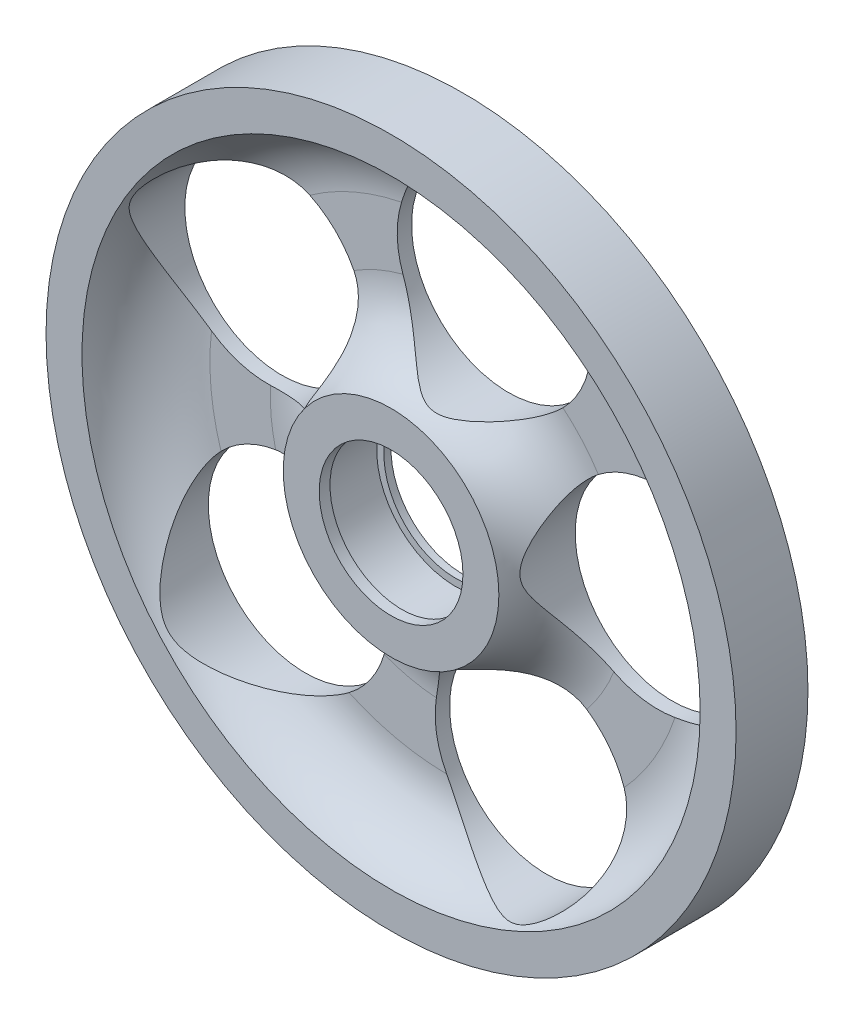
from build123d import *

# Parameters (mm, degrees)
SKETCH1_R           = 48
SKETCH1_R_2         = 10
BOSS_EXTRUDE1_DEPTH = 10
CUT_EXTRUDE1_START  = -1.5
SKETCH2_R           = 11
CUT_EXTRUDE1_DEPTH  = 7.5
SKETCH3_R           = 43
SKETCH3_R_2         = 15
CUT_EXTRUDE2_DEPTH  = 8
SKETCH4_R           = 13.5
CUT_EXTRUDE3_DEPTH  = 8
FILLET1_START       = 2
FILLET1_OUTLINE_R   = 43
FILLET1_OUTLINE_R_2 = 13.5
FILLET1_OUTLINE_R_3 = 15
FILLET1_DEPTH       = 8.0000001


with BuildPart() as part:
    # Sketch1 → Boss-Extrude1 (new body)
    with BuildSketch(Plane.XY):
        Circle(SKETCH1_R)
        Circle(SKETCH1_R_2, mode=Mode.SUBTRACT)
    extrude(amount=BOSS_EXTRUDE1_DEPTH)

    # Sketch2 → Cut-Extrude1 (cut)
    with BuildSketch(Plane.XY.offset(10).offset(CUT_EXTRUDE1_START)):
        Circle(SKETCH2_R)
    extrude(amount=-CUT_EXTRUDE1_DEPTH, mode=Mode.SUBTRACT)

    # Sketch3 → Cut-Extrude2 (cut)
    with BuildSketch(Plane.XY.offset(10)):
        Circle(SKETCH3_R)
        Circle(SKETCH3_R_2, mode=Mode.SUBTRACT)
    extrude(amount=-CUT_EXTRUDE2_DEPTH, mode=Mode.SUBTRACT)

    # Sketch4 → Cut-Extrude3 (cut)
    with BuildSketch(Plane.XY.offset(2)):
        with Locations((-21.923747427, -19.362639251)):
            Circle(SKETCH4_R)
        with Locations((-25.189774768, 14.867338267)):
            Circle(SKETCH4_R)
        with Locations((6.355610451, 28.551159623)):
            Circle(SKETCH4_R)
        with Locations((29.117758046, 2.778248798)):
            Circle(SKETCH4_R)
        with Locations((11.640153697, -26.834107436)):
            Circle(SKETCH4_R)
    extrude(amount=-CUT_EXTRUDE3_DEPTH, mode=Mode.SUBTRACT)

    # Fillet1: read off the stored shape, not the designer's step
    # Fillet1 outline → Fillet1 (add)
    with BuildSketch(Plane.XY.offset(FILLET1_START)):
        Circle(FILLET1_OUTLINE_R)
        with Locations((-21.923747427, -19.362639251)):
            Circle(FILLET1_OUTLINE_R_2, mode=Mode.SUBTRACT)
        with Locations((11.640153697, -26.834107436)):
            Circle(FILLET1_OUTLINE_R_2, mode=Mode.SUBTRACT)
        with Locations((-25.189774768, 14.867338267)):
            Circle(FILLET1_OUTLINE_R_2, mode=Mode.SUBTRACT)
        Circle(FILLET1_OUTLINE_R_3, mode=Mode.SUBTRACT)
        with Locations((29.117758046, 2.778248798)):
            Circle(FILLET1_OUTLINE_R_2, mode=Mode.SUBTRACT)
        with Locations((6.355610451, 28.551159623)):
            Circle(FILLET1_OUTLINE_R_2, mode=Mode.SUBTRACT)
    extrude(amount=FILLET1_DEPTH)

    # Fillet1 2 outline → Fillet1 2 (revolve, cut)
    with BuildSketch(Plane.XZ):
        with BuildLine():
            ThreePointArc((15, 10), (18.473403651, 4.254033308), (24.797958971, 2))
            Line((24.797958971, 2), (33.202041029, 2))
            ThreePointArc((33.202041029, 2), (39.526596349, 4.254033308), (43, 10))
            Line((43, 10), (15, 10))
        make_face()
    revolve(axis=Axis((0, 0, 0), (0, 0, 1)), mode=Mode.SUBTRACT)


solid = part.part
